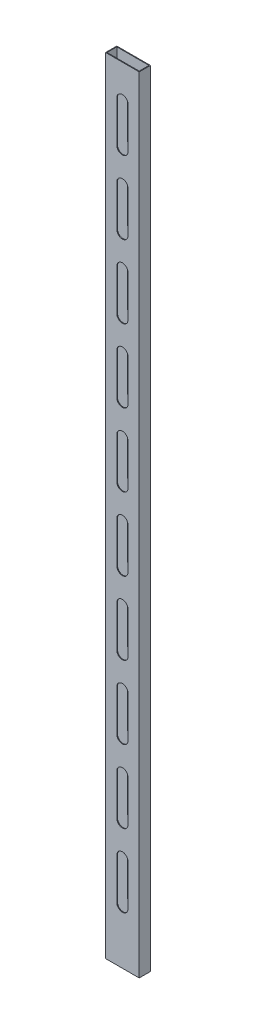
from build123d import *

# Parameters (mm, degrees)
SKETCH1_W           = 76.2
SKETCH1_H           = 25.4
SKETCH1_W_2         = 73.025
SKETCH1_H_2         = 22.225
BOSS_EXTRUDE1_DEPTH = 1778
CUT_EXTRUDE1_DEPTH  = 1780.813361002


with BuildPart() as part:
    # Sketch1 → Boss-Extrude1 (new body)
    with BuildSketch(Plane(origin=(0, 0, 0), x_dir=(1, 0, 0), z_dir=(0, 1, 0))):
        with Locations((-38.1, 12.7)):
            Rectangle(SKETCH1_W, SKETCH1_H)
        with Locations((-38.1, 12.7)):
            Rectangle(SKETCH1_W_2, SKETCH1_H_2, mode=Mode.SUBTRACT)
    extrude(amount=BOSS_EXTRUDE1_DEPTH)

    # Sketch2 → Cut-Extrude1 (cut, through all)
    with BuildSketch(Plane.XY):
        with BuildLine():
            Line((-25.4, 1701.8), (-25.4, 1608.697688474))
            ThreePointArc((-25.4, 1608.697688474), (-38.1, 1595.997688474), (-50.8, 1608.697688474))
            Line((-50.8, 1608.697688474), (-50.8, 1701.8))
            ThreePointArc((-50.8, 1701.8), (-38.1, 1714.5), (-25.4, 1701.8))
        make_face()
        with BuildLine():
            Line((-25.4, 1536.7), (-25.4, 1443.597688474))
            ThreePointArc((-25.4, 1443.597688474), (-38.1, 1430.897688474), (-50.8, 1443.597688474))
            Line((-50.8, 1443.597688474), (-50.8, 1536.7))
            ThreePointArc((-50.8, 1536.7), (-38.1, 1549.4), (-25.4, 1536.7))
        make_face()
        with BuildLine():
            Line((-25.4, 1371.6), (-25.4, 1278.497688474))
            ThreePointArc((-25.4, 1278.497688474), (-38.1, 1265.797688474), (-50.8, 1278.497688474))
            Line((-50.8, 1278.497688474), (-50.8, 1371.6))
            ThreePointArc((-50.8, 1371.6), (-38.1, 1384.3), (-25.4, 1371.6))
        make_face()
        with BuildLine():
            Line((-25.4, 1206.5), (-25.4, 1113.397688474))
            ThreePointArc((-25.4, 1113.397688474), (-38.1, 1100.697688474), (-50.8, 1113.397688474))
            Line((-50.8, 1113.397688474), (-50.8, 1206.5))
            ThreePointArc((-50.8, 1206.5), (-38.1, 1219.2), (-25.4, 1206.5))
        make_face()
        with BuildLine():
            Line((-25.4, 1041.4), (-25.4, 948.297688474))
            ThreePointArc((-25.4, 948.297688474), (-38.1, 935.597688474), (-50.8, 948.297688474))
            Line((-50.8, 948.297688474), (-50.8, 1041.4))
            ThreePointArc((-50.8, 1041.4), (-38.1, 1054.1), (-25.4, 1041.4))
        make_face()
        with BuildLine():
            Line((-25.4, 876.3), (-25.4, 783.197688474))
            ThreePointArc((-25.4, 783.197688474), (-38.1, 770.497688474), (-50.8, 783.197688474))
            Line((-50.8, 783.197688474), (-50.8, 876.3))
            ThreePointArc((-50.8, 876.3), (-38.1, 889), (-25.4, 876.3))
        make_face()
        with BuildLine():
            Line((-25.4, 711.2), (-25.4, 618.097688474))
            ThreePointArc((-25.4, 618.097688474), (-38.1, 605.397688474), (-50.8, 618.097688474))
            Line((-50.8, 618.097688474), (-50.8, 711.2))
            ThreePointArc((-50.8, 711.2), (-38.1, 723.9), (-25.4, 711.2))
        make_face()
        with BuildLine():
            Line((-25.4, 546.1), (-25.4, 452.997688474))
            ThreePointArc((-25.4, 452.997688474), (-38.1, 440.297688474), (-50.8, 452.997688474))
            Line((-50.8, 452.997688474), (-50.8, 546.1))
            ThreePointArc((-50.8, 546.1), (-38.1, 558.8), (-25.4, 546.1))
        make_face()
        with BuildLine():
            Line((-25.4, 381), (-25.4, 287.897688474))
            ThreePointArc((-25.4, 287.897688474), (-38.1, 275.197688474), (-50.8, 287.897688474))
            Line((-50.8, 287.897688474), (-50.8, 381))
            ThreePointArc((-50.8, 381), (-38.1, 393.7), (-25.4, 381))
        make_face()
        with BuildLine():
            Line((-25.4, 215.9), (-25.4, 122.797688474))
            ThreePointArc((-25.4, 122.797688474), (-38.1, 110.097688474), (-50.8, 122.797688474))
            Line((-50.8, 122.797688474), (-50.8, 215.9))
            ThreePointArc((-50.8, 215.9), (-38.1, 228.6), (-25.4, 215.9))
        make_face()
    extrude(amount=-CUT_EXTRUDE1_DEPTH, mode=Mode.SUBTRACT)


solid = part.part
